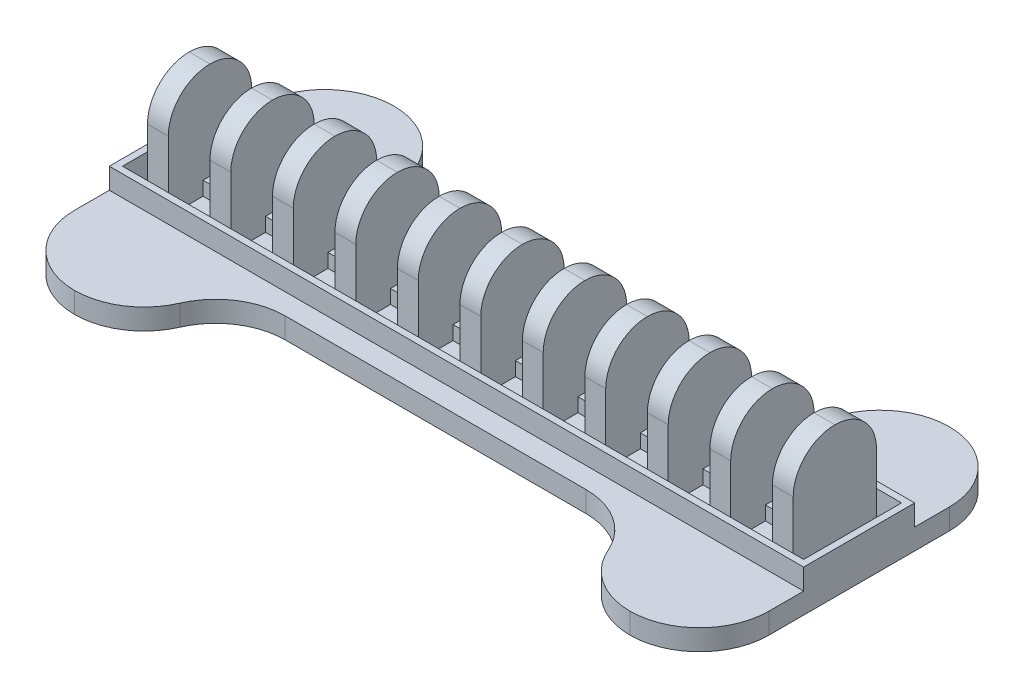
from build123d import *

# Parameters (mm, degrees)
SKETCH1_W            = 100
SKETCH1_H            = 16
BOSS_EXTRUDE1_DEPTH  = 3
SKETCH2_W            = 98
SKETCH2_H            = 14
CUT_EXTRUDE1_DEPTH   = 1
SKETCH5_W            = 20
SKETCH5_H            = 3
BOSS_EXTRUDE4_DEPTH  = 15
SKETCH6_W            = 20
SKETCH6_H            = 3
BOSS_EXTRUDE5_DEPTH  = 15
FILLET18_R           = 10
SKETCH7_W            = 3
SKETCH7_H            = 12
BOSS_EXTRUDE6_DEPTH  = 16
SKETCH8_W            = 6
SKETCH8_H            = 2
BOSS_EXTRUDE7_DEPTH  = 2
FILLET19_R           = 6
SKETCH10_W           = 60
SKETCH10_H           = 3
BOSS_EXTRUDE8_DEPTH  = 3
SKETCH11_W           = 60
SKETCH11_H           = 3
BOSS_EXTRUDE9_DEPTH  = 3
SKETCH12_W           = 0.95
SKETCH12_H           = 14
BOSS_EXTRUDE10_DEPTH = 3
SKETCH13_W           = 100
SKETCH13_H           = 0.95
BOSS_EXTRUDE11_DEPTH = 3
SKETCH14_W           = 0.95
SKETCH14_H           = 0.052088128
BOSS_EXTRUDE12_DEPTH = 3
SKETCH15_W           = 0.95
SKETCH15_H           = 0.047911872
SKETCH15_W_2         = 0.949734752
SKETCH15_H_2         = 0.052088128
BOSS_EXTRUDE13_DEPTH = 3
FILLET20_R           = 10
SKETCH17_W           = 98.1
SKETCH17_H           = 14.1
SKETCH17_W_2         = 97.1
SKETCH17_H_2         = 13.1
CUT_EXTRUDE2_DEPTH   = 4


with BuildPart() as part:
    # Sketch1 → Boss-Extrude1 (new body)
    with BuildSketch(Plane(origin=(0, 0, 0), x_dir=(1, 0, 0), z_dir=(0, 1, 0))):
        with Locations((50, 8)):
            Rectangle(SKETCH1_W, SKETCH1_H)
    extrude(amount=BOSS_EXTRUDE1_DEPTH)

    # Sketch2 → Cut-Extrude1 (cut)
    with BuildSketch(Plane(origin=(0, 3, 0), x_dir=(1, 0, 0), z_dir=(0, 1, 0))):
        with Locations((50, 8)):
            Rectangle(SKETCH2_W, SKETCH2_H)
    extrude(amount=-CUT_EXTRUDE1_DEPTH, mode=Mode.SUBTRACT)

    # Sketch5 → Boss-Extrude4 (add)
    with BuildSketch(Plane.XY):
        with Locations((10, 1.5)):
            Rectangle(SKETCH5_W, SKETCH5_H)
        with Locations((90, 1.5)):
            Rectangle(SKETCH5_W, SKETCH5_H)
    extrude(amount=BOSS_EXTRUDE4_DEPTH)

    # Sketch6 → Boss-Extrude5 (add)
    with BuildSketch(Plane(origin=(0, 0, -16), x_dir=(-1, 0, 0), z_dir=(0, 0, -1))):
        with Locations((-90, 1.5)):
            Rectangle(SKETCH6_W, SKETCH6_H)
        with Locations((-10, 1.5)):
            Rectangle(SKETCH6_W, SKETCH6_H)
    extrude(amount=BOSS_EXTRUDE5_DEPTH)

    # Fillet18
    fillet18_edges = [part.edges().sort_by_distance(p)[0] for p in [
        (20, 1.5, 15),
        (0, 1.5, 15),
        (80, 1.5, 15),
        (100, 1.5, 15),
        (0, 1.5, -31),
        (20, 1.5, -31),
        (80, 1.5, -31),
        (100, 1.5, -31),
    ]]
    fillet(fillet18_edges, radius=FILLET18_R - 0.0001)  # a hair under: the kernel refuses the full size

    # Sketch7 → Boss-Extrude6 (add)
    with BuildSketch(Plane(origin=(0, 2, 0), x_dir=(1, 0, 0), z_dir=(0, 1, 0))):
        with Locations((95, 8)):
            Rectangle(SKETCH7_W, SKETCH7_H)
        with Locations((86, 8)):
            Rectangle(SKETCH7_W, SKETCH7_H)
        with Locations((77, 8)):
            Rectangle(SKETCH7_W, SKETCH7_H)
        with Locations((68, 8)):
            Rectangle(SKETCH7_W, SKETCH7_H)
        with Locations((59, 8)):
            Rectangle(SKETCH7_W, SKETCH7_H)
        with Locations((50, 8)):
            Rectangle(SKETCH7_W, SKETCH7_H)
        with Locations((41, 8)):
            Rectangle(SKETCH7_W, SKETCH7_H)
        with Locations((32, 8)):
            Rectangle(SKETCH7_W, SKETCH7_H)
        with Locations((23, 8)):
            Rectangle(SKETCH7_W, SKETCH7_H)
        with Locations((14, 8)):
            Rectangle(SKETCH7_W, SKETCH7_H)
        with Locations((5, 8)):
            Rectangle(SKETCH7_W, SKETCH7_H)
    extrude(amount=BOSS_EXTRUDE6_DEPTH)

    # Sketch8 → Boss-Extrude7 (add)
    with BuildSketch(Plane(origin=(0, 2, 0), x_dir=(1, 0, 0), z_dir=(0, 1, 0))):
        with Locations((90.5, 8)):
            Rectangle(SKETCH8_W, SKETCH8_H)
        with Locations((81.5, 8)):
            Rectangle(SKETCH8_W, SKETCH8_H)
        with Locations((72.5, 8)):
            Rectangle(SKETCH8_W, SKETCH8_H)
        with Locations((63.5, 8)):
            Rectangle(SKETCH8_W, SKETCH8_H)
        with Locations((54.5, 8)):
            Rectangle(SKETCH8_W, SKETCH8_H)
        with Locations((45.5, 8)):
            Rectangle(SKETCH8_W, SKETCH8_H)
        with Locations((36.5, 8)):
            Rectangle(SKETCH8_W, SKETCH8_H)
        with Locations((27.5, 8)):
            Rectangle(SKETCH8_W, SKETCH8_H)
        with Locations((18.5, 8)):
            Rectangle(SKETCH8_W, SKETCH8_H)
        with Locations((9.5, 8)):
            Rectangle(SKETCH8_W, SKETCH8_H)
    extrude(amount=BOSS_EXTRUDE7_DEPTH)

    # Fillet19
    fillet19_edges = [part.edges().sort_by_distance(p)[0] for p in [
        (95, 18, -2),
        (95, 18, -14),
        (86, 18, -2),
        (86, 18, -14),
        (77, 18, -2),
        (77, 18, -14),
        (68, 18, -2),
        (68, 18, -14),
        (59, 18, -2),
        (59, 18, -14),
        (50, 18, -2),
        (50, 18, -14),
        (41, 18, -2),
        (41, 18, -14),
        (32, 18, -2),
        (32, 18, -14),
        (23, 18, -14),
        (23, 18, -2),
        (14, 18, -2),
        (14, 18, -14),
        (5, 18, -2),
        (5, 18, -14),
    ]]
    fillet(fillet19_edges, radius=FILLET19_R - 0.0001)  # a hair under: the kernel refuses the full size

    # Sketch10 → Boss-Extrude8 (add)
    with BuildSketch(Plane(origin=(0, 0, -16), x_dir=(-1, 0, 0), z_dir=(0, 0, -1))):
        with Locations((-50, 1.5)):
            Rectangle(SKETCH10_W, SKETCH10_H)
    extrude(amount=BOSS_EXTRUDE8_DEPTH)

    # Sketch11 → Boss-Extrude9 (add)
    with BuildSketch(Plane.XY):
        with Locations((50, 1.5)):
            Rectangle(SKETCH11_W, SKETCH11_H)
    extrude(amount=BOSS_EXTRUDE9_DEPTH)

    # Sketch12 → Boss-Extrude10 (add)
    with BuildSketch(Plane(origin=(0, 3, 0), x_dir=(1, 0, 0), z_dir=(0, 1, 0))):
        with Locations((99.525, 7.997911872)):
            Rectangle(SKETCH12_W, SKETCH12_H)
        with Locations((0.475, 7.997911872)):
            Rectangle(SKETCH12_W, SKETCH12_H)
    extrude(amount=BOSS_EXTRUDE10_DEPTH)

    # Sketch13 → Boss-Extrude11 (add)
    with BuildSketch(Plane(origin=(0, 3, 0), x_dir=(1, 0, 0), z_dir=(0, 1, 0))):
        with Locations((50, 15.525)):
            Rectangle(SKETCH13_W, SKETCH13_H)
        with Locations((50, 0.475)):
            Rectangle(SKETCH13_W, SKETCH13_H)
    extrude(amount=BOSS_EXTRUDE11_DEPTH)

    # Sketch14 → Boss-Extrude12 (add)
    with BuildSketch(Plane(origin=(0, 3, 0), x_dir=(1, 0, 0), z_dir=(0, 1, 0))):
        with Locations((0.475, 15.023955936)):
            Rectangle(SKETCH14_W, SKETCH14_H)
    extrude(amount=BOSS_EXTRUDE12_DEPTH)

    # Sketch15 → Boss-Extrude13 (add)
    with BuildSketch(Plane(origin=(0, 3, 0), x_dir=(1, 0, 0), z_dir=(0, 1, 0))):
        with Locations((0.475, 0.973955936)):
            Rectangle(SKETCH15_W, SKETCH15_H)
        with Locations((99.525132624, 0.973955936)):
            Rectangle(SKETCH15_W_2, SKETCH15_H)
        with Locations((99.525, 15.023955936)):
            Rectangle(SKETCH15_W, SKETCH15_H_2)
    extrude(amount=BOSS_EXTRUDE13_DEPTH)

    # Fillet20
    fillet20_edges = [part.edges().sort_by_distance(p)[0] for p in [
        (20, 1.5, -19),
        (80, 1.5, -19),
        (80, 1.5, 3),
        (20, 1.5, 3),
    ]]
    fillet(fillet20_edges, radius=FILLET20_R)

    # Sketch17 → Cut-Extrude2 (cut)
    with BuildSketch(Plane(origin=(0, 6, 0), x_dir=(1, 0, 0), z_dir=(0, 1, 0))):
        with Locations((50, 8)):
            Rectangle(SKETCH17_W, SKETCH17_H)
        with Locations((50, 8)):
            Rectangle(SKETCH17_W_2, SKETCH17_H_2, mode=Mode.SUBTRACT)
    extrude(amount=-CUT_EXTRUDE2_DEPTH, mode=Mode.SUBTRACT)


solid = part.part
